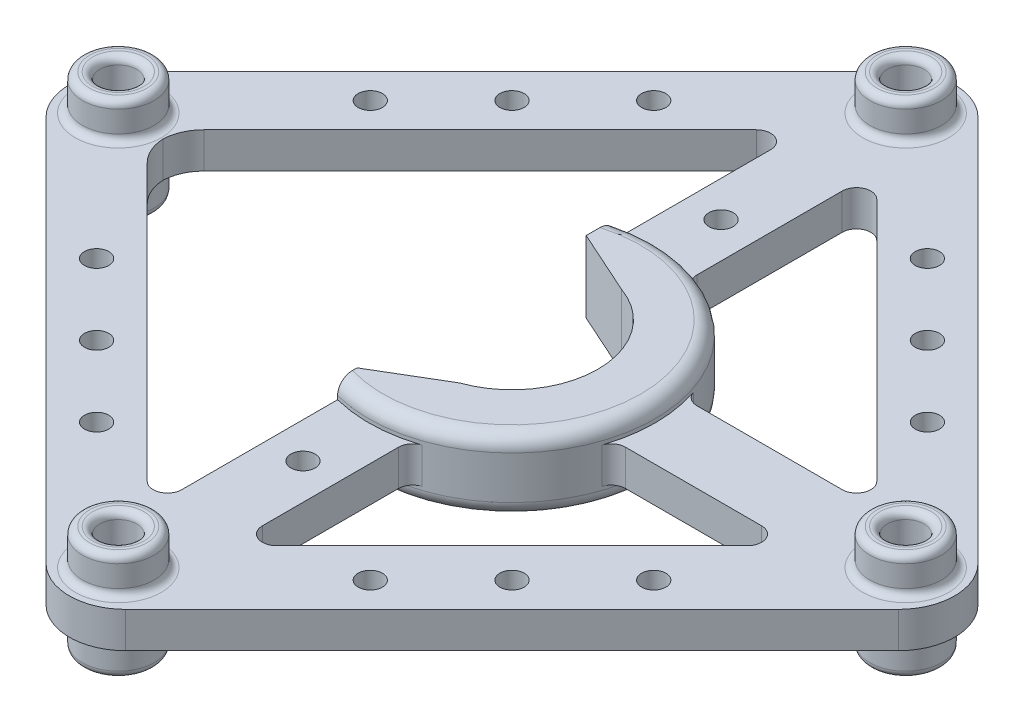
from build123d import *
from build123d.topology import SkipClean

# Parameters (mm, degrees)
SKETCH1_R                                  = 25.4
SKETCH1_R_2                                = 15.24
BOSS_EXTRUDE1_DEPTH                        = 6.35
BOSS_EXTRUDE2_START                        = -6.35
BOSS_EXTRUDE2_DEPTH                        = 3.175
CIRPATTERN1_COUNT                          = 4
CUT_EXTRUDE1_DEPTH                         = 111.990216985
BOSS_EXTRUDE5_DEPTH                        = 3.175
MIRROR1_START                              = -3.175
MIRROR1_DEPTH                              = 3.175
MIRROR1_START_2                            = -6.35
MIRROR1_2_DEPTH                            = 3.175
FILLET4_R                                  = 2.54
BOSS_EXTRUDE7_DEPTH                        = 6.35
SKETCH16_R                                 = 7.9375
BOSS_EXTRUDE8_DEPTH                        = 6.35
MIRROR5_AT_THE_SECOND_PLANE_COPY_1_DEPTH   = 6.35
BOSS_EXTRUDE10_START                       = 6.35
SKETCH20_R                                 = 6.35
SKETCH20_R_2                               = 3.2639
BOSS_EXTRUDE10_DEPTH                       = 6.35
CIRPATTERN5_COUNT                          = 4
FILLET6_R                                  = 10
FILLET7_R                                  = 2.54
SKETCH18_R                                 = 2.15265
CUT_EXTRUDE4_DEPTH                         = 112.789343907
MIRROR6_AT_THE_SECOND_PLANE_COPY_1_SKETC_R = 2.15265
MIRROR6_AT_THE_SECOND_PLANE_COPY_1_DEPTH   = 112.789343907
FILLET8_R                                  = 2.54
FILLET10_R                                 = 7.62
FILLET11_R                                 = 1.27
CIRPATTERN7_COUNT                          = 4
FILLET11_OF_CIRPATTERN7_R                  = 1.27
SKETCH21_R                                 = 2.15265
CUT_EXTRUDE5_DEPTH                         = 112.789343907


# Read off the part's stored shape, not the designer's step: Mirror1, Mirror8
with BuildPart() as part:
    # Sketch1 → Boss-Extrude1 (new body)
    with BuildSketch(Plane(origin=(0, 0, 0), x_dir=(1, 0, 0), z_dir=(0, 1, 0))):
        with Locations(Location((0, 0, 0), (0, 0, 270))):
            Circle(SKETCH1_R)
        with Locations(Location((0, 0, 0), (0, 0, 270))):
            Circle(SKETCH1_R_2, mode=Mode.SUBTRACT)
    extrude(amount=BOSS_EXTRUDE1_DEPTH)

    # Sketch2 → Boss-Extrude2 (add)
    with BuildSketch(Plane(origin=(0, 6.35, 0), x_dir=(1, 0, 0), z_dir=(0, 1, 0)).offset(BOSS_EXTRUDE2_START)):
        with BuildLine():
            Line((73.590884631, -6.35), (16.699754169, -6.35))
            Line((16.699754169, -6.35), (16.699754169, 6.35))
            Line((16.699754169, 6.35), (73.590884631, 6.35))
            ThreePointArc((73.590884631, 6.35), (76.958480677, 4.955096045), (78.353384631, 1.5875))
            Line((78.353384631, 1.5875), (78.353384631, -1.5875))
            ThreePointArc((78.353384631, -1.5875), (76.958480677, -4.955096045), (73.590884631, -6.35))
        make_face()
    boss_extrude2 = extrude(amount=BOSS_EXTRUDE2_DEPTH)

    # CirPattern1: Boss-Extrude2 ×4 about axis
    cirpattern1_axis = Axis((0, 0, 0), (0, 1, 0))
    for i in range(1, CIRPATTERN1_COUNT):
        add(boss_extrude2.rotate(cirpattern1_axis, i * 360 / CIRPATTERN1_COUNT))

    # Sketch5 → Cut-Extrude1 (cut, through all)
    with BuildSketch(Plane(origin=(0, 6.35, 0), x_dir=(1, 0, 0), z_dir=(0, 1, 0))):
        Polygon((-6.35, 19.513444248), (-6.35, 24.593444248), (-6.35, 52.536571615), (-88.152777481, 52.536571615), (-88.152777481, -52.536571615), (-6.35, -52.536571615), (-6.35, -26.229804731), (-6.35, -21.149804731), (5.08, -14.368409794), (5.08, 14.368409794), align=None)
    extrude(amount=-CUT_EXTRUDE1_DEPTH, mode=Mode.SUBTRACT)

    # Sketch12 → Boss-Extrude5 (add)
    with BuildSketch(Plane(origin=(0, 0, 0), x_dir=(1, 0, 0), z_dir=(0, 1, 0))):
        with BuildLine():
            Line((-3.367596045, -66.482403955), (66.482403955, 3.367596045))
            ThreePointArc((66.482403955, 3.367596045), (73.217596045, 3.367596045), (73.217596045, -3.367596045))
            Line((73.217596045, -3.367596045), (3.367596045, -73.217596045))
            ThreePointArc((3.367596045, -73.217596045), (-3.367596045, -73.217596045), (-3.367596045, -66.482403955))
        make_face()
    extrude(amount=BOSS_EXTRUDE5_DEPTH)

    # Mirror1 outline → Mirror1 (add)
    with BuildSketch(Plane(origin=(0, 0, 0), x_dir=(1, 0, 0), z_dir=(0, 1, 0)).offset(MIRROR1_START)):
        with BuildLine():
            Line((73.590884631, 6.35), (24.593444248, 6.35))
            ThreePointArc((24.593444248, 6.35), (17.960512242, 17.960512242), (6.35, 24.593444248))
            Line((6.35, 24.593444248), (6.35, 73.590884631))
            ThreePointArc((6.35, 73.590884631), (4.955096046, 76.958480677), (1.5875, 78.353384631))
            Line((1.5875, 78.353384631), (-1.5875, 78.353384631))
            ThreePointArc((-1.5875, 78.353384631), (-4.955096046, 76.958480677), (-6.35, 73.590884631))
            Line((-6.35, 73.590884631), (-6.35, 19.513444248))
            Line((-6.35, 19.513444248), (5.08, 14.368409794))
            ThreePointArc((5.08, 14.368409794), (15.24, 0), (5.08, -14.368409794))
            Line((5.08, -14.368409794), (-6.35, -21.149804731))
            Line((-6.35, -21.149804731), (-6.35, -73.590884631))
            ThreePointArc((-6.35, -73.590884631), (-4.955096046, -76.958480677), (-1.5875, -78.353384631))
            Line((-1.5875, -78.353384631), (1.5875, -78.353384631))
            ThreePointArc((1.5875, -78.353384631), (4.955096046, -76.958480677), (6.35, -73.590884631))
            Line((6.35, -73.590884631), (6.35, -70.235192091))
            Line((6.35, -70.235192091), (70.235192091, -6.35))
            Line((70.235192091, -6.35), (73.590884631, -6.35))
            ThreePointArc((73.590884631, -6.35), (76.958480677, -4.955096046), (78.353384631, -1.5875))
            Line((78.353384631, -1.5875), (78.353384631, 1.5875))
            ThreePointArc((78.353384631, 1.5875), (76.958480677, 4.955096046), (73.590884631, 6.35))
        make_face()
        with BuildLine():
            Line((24.593444248, -6.35), (56.764807909, -6.35))
            Line((56.764807909, -6.35), (6.35, -56.764807909))
            Line((6.35, -56.764807909), (6.35, -24.593444248))
            ThreePointArc((6.35, -24.593444248), (17.960512242, -17.960512242), (24.593444248, -6.35))
        make_face(mode=Mode.SUBTRACT)
    extrude(amount=MIRROR1_DEPTH)

    # Mirror1 2 outline → Mirror1 2 (add)
    with BuildSketch(Plane(origin=(0, 0, 0), x_dir=(1, 0, 0), z_dir=(0, 1, 0)).offset(MIRROR1_START_2)):
        with BuildLine():
            ThreePointArc((-6.35, -24.593444248), (25.4, 0), (-6.35, 24.593444248))
            Line((-6.35, 24.593444248), (-6.35, 19.513444248))
            Line((-6.35, 19.513444248), (5.08, 14.368409794))
            ThreePointArc((5.08, 14.368409794), (15.24, 0), (5.08, -14.368409794))
            Line((5.08, -14.368409794), (-6.35, -21.149804731))
            Line((-6.35, -21.149804731), (-6.35, -24.593444248))
        make_face()
    extrude(amount=MIRROR1_2_DEPTH)

    # Fillet4
    # the kernel refuses this fillet: 2.54 mm, written as the material it adds along each edge
    with BuildSketch(Plane(origin=(24.593444248, 3.175, -6.35), x_dir=(1, 0, 0), z_dir=(0, -1, 0)), Plane(origin=(6.35, 3.175, 24.593444248), x_dir=(0, 0, 1), z_dir=(0, -1, 0)), Plane(origin=(6.35, -3.175, -24.593444248), x_dir=(0, 0, -1), z_dir=(0, 1, 0))) as fillet4_piece_1:
        with BuildLine():
            CenterArc((1.894505842, -2.54), FILLET4_R, 90, 71.446995465)
            ThreePointArc((-0.513489621, -1.731818182), (-0.241344994, -0.870475186), (0, 0))
            Line((0, 0), (1.894505842, 0))
        make_face()
    extrude(amount=3.175)
    with BuildSketch(Plane(origin=(24.593444248, 3.175, 6.35), x_dir=(1, 0, 0), z_dir=(0, -1, 0)), Plane(origin=(6.35, 3.175, -24.593444248), x_dir=(0, 0, -1), z_dir=(0, -1, 0))) as fillet4_piece_2:
        with BuildLine():
            CenterArc((1.894505842, 2.54), FILLET4_R, 198.553004535, 71.446995465)
            ThreePointArc((-0.513489621, 1.731818182), (-0.241344994, 0.870475186), (0, 0))
            Line((0, 0), (1.894505842, 0))
        make_face()
    extrude(amount=3.175)
    with BuildSketch(Plane(origin=(6.35, -3.175, 24.593444248), x_dir=(0.9587440651387001, 0, -0.2842706765766038), z_dir=(0, 1, 0)), Plane(origin=(24.593444248, -3.175, -6.35), x_dir=(-0.2842706765766039, 0, -0.9587440651387), z_dir=(0, 1, 0))) as fillet4_piece_3:
        with BuildLine():
            CenterArc((1.896657468, -2.538393751), FILLET4_R, 92.037746175, 71.446995466)
            Line((-0.538552458, -1.816346233), (0, 0))
            ThreePointArc((0, 0), (0.903170223, -0.016062489), (1.806340446, 0))
        make_face()
    extrude(amount=3.175)
    with BuildSketch(Plane(origin=(24.593444248, -3.175, 6.35), x_dir=(-0.2842706765766016, 0, 0.9587440651387007), z_dir=(0, 1, 0))) as fillet4_piece_4:
        with BuildLine():
            CenterArc((1.896657468, 2.538393751), FILLET4_R, 196.515258359, 71.446995466)
            Line((-0.538552458, 1.816346233), (0, 0))
            ThreePointArc((0, 0), (0.903170223, 0.016062489), (1.806340446, 0))
        make_face()
    extrude(amount=3.175)

    # Sketch15 → Boss-Extrude7 (add)
    with SkipClean():  # the faces are left unmerged after this step: merging them gives an invalid solid
        with BuildSketch(Plane(origin=(0, 3.175, 0), x_dir=(1, 0, 0), z_dir=(0, 1, 0))):
            Polygon((-82.677748493, 0), (0, -82.677), (0, -64.716569057), (-64.71715495, 0), align=None)
        boss_extrude7 = extrude(amount=-BOSS_EXTRUDE7_DEPTH)

    # Sketch16 → Boss-Extrude8 (add)
    with SkipClean():  # the faces are left unmerged after this step: merging them gives an invalid solid
        with BuildSketch(Plane(origin=(0, 3.175, 0), x_dir=(1, 0, 0), z_dir=(0, 1, 0))):
            with Locations((-69.85, 0)):
                Circle(SKETCH16_R)
        extrude(amount=-BOSS_EXTRUDE8_DEPTH)

    # Mirror5: Boss-Extrude7 across plane
    with SkipClean():  # the faces are left unmerged after this step: merging them gives an invalid solid
        add(boss_extrude7.mirror(Plane(origin=(0, 0, 0), x_dir=(0, 0, 1), z_dir=(1, 0, 0))))

    # Mirror5 at the second plane: Boss-Extrude7 across plane
    with SkipClean():  # the faces are left unmerged after this step: merging them gives an invalid solid
        add(boss_extrude7.mirror(Plane.XY))

    # Mirror5 at the second plane copy 1 sketc → Mirror5 at the second plane copy 1 (add)
    with SkipClean():  # the faces are left unmerged after this step: merging them gives an invalid solid
        with BuildSketch(Plane(origin=(0, 3.175, 0), x_dir=(-1, 0, 0), z_dir=(0, 1, 0))):
            Polygon((-82.677748493, 0), (0, -82.677), (0, -64.716569057), (-64.71715495, 0), align=None)
        extrude(amount=-MIRROR5_AT_THE_SECOND_PLANE_COPY_1_DEPTH)

    # Sketch14 → F (0.257) Diameter Hole2 (revolve, cut)
    with SkipClean():  # the faces are left unmerged after this step: merging them gives an invalid solid
        with BuildSketch(Plane(origin=(0, 3.175, 69.85), x_dir=(0, 0, 1), z_dir=(1, 0, 0))):
            Polygon((0, 0), (0, 52.761148974), (3.2639, 50.8), (3.2639, 0), align=None)
        f_0_257_diameter_hole2 = revolve(axis=Axis((0, 9.525, 69.85), (0, -1, 0)), mode=Mode.SUBTRACT)

    # Sketch20 → Boss-Extrude10 (add)
    with SkipClean():  # the faces are left unmerged after this step: merging them gives an invalid solid
        with BuildSketch(Plane(origin=(0, 3.175, 0), x_dir=(1, 0, 0), z_dir=(0, 1, 0)).offset(BOSS_EXTRUDE10_START)):
            with Locations(Location((0, -69.85, 0), (0, 0, 270))):
                Circle(SKETCH20_R)
            with Locations(Location((0, -69.85, 0), (0, 0, 270))):
                Circle(SKETCH20_R_2, mode=Mode.SUBTRACT)
        boss_extrude10 = extrude(amount=-BOSS_EXTRUDE10_DEPTH)

    # CirPattern5: F (0.257) Diameter Hole2 ×4 about axis
    with SkipClean():  # the faces are left unmerged after this step: merging them gives an invalid solid
        cirpattern5_axis = Axis((0, 0, 0), (0, 1, 0))
        for i in range(1, CIRPATTERN5_COUNT):
            add(f_0_257_diameter_hole2.rotate(cirpattern5_axis, i * 360 / CIRPATTERN5_COUNT), mode=Mode.SUBTRACT)

    # Fillet6
    # the kernel refuses this fillet: 10 mm, written as the material it takes off along each edge
    with BuildSketch(Plane(origin=(0, 28.174773672, 82.677), x_dir=(0.7071099819596428, 0, -0.7071035803989637), z_dir=(0, -1, 0))) as fillet6_piece_1:
        with BuildLine():
            CenterArc((FILLET6_R * 0.999990946867, -FILLET6_R), FILLET6_R, 90, 89.999481291)
            Line((-FILLET6_R * 9.05309197351e-06, -FILLET6_R * 0.999990946826), (0, 0))
            Line((0, 0), (FILLET6_R * 0.999990946867, 0))
        make_face()
    extrude(amount=56.349547343, mode=Mode.SUBTRACT)
    with BuildSketch(Plane(origin=(-82.677748493, 28.17522633, 0), x_dir=(0.7071099819596426, 0, 0.7071035803989637), z_dir=(0, -1, 0)), Plane(origin=(82.677748493, 28.17522633, 0), x_dir=(-0.7071099819596426, 0, -0.7071035803989637), z_dir=(0, -1, 0))) as fillet6_piece_2:
        with BuildLine():
            CenterArc((FILLET6_R * 1.00000905321, -FILLET6_R), FILLET6_R, 90, 90.000518709)
            Line((FILLET6_R * 9.05325589292e-06, -FILLET6_R * 1.00000905317), (0, 0))
            Line((0, 0), (FILLET6_R * 1.00000905321, 0))
        make_face()
    extrude(amount=56.350452661, mode=Mode.SUBTRACT)
    with BuildSketch(Plane(origin=(0, 28.174773672, -82.677), x_dir=(0.7071099819596428, 0, 0.7071035803989637), z_dir=(0, -1, 0))) as fillet6_piece_3:
        with BuildLine():
            CenterArc((FILLET6_R * 0.999990946867, FILLET6_R), FILLET6_R, 180.000518709, 89.999481291)
            Line((-FILLET6_R * 9.05309197351e-06, FILLET6_R * 0.999990946826), (0, 0))
            Line((0, 0), (FILLET6_R * 0.999990946867, 0))
        make_face()
    extrude(amount=56.349547343, mode=Mode.SUBTRACT)

    # Fillet7
    fillet7_edges = [part.edges().sort_by_distance(p)[0] for p in [
        (25.4, 6.35, 0),
        (25.4, -6.35, 0),
    ]]
    fillet(fillet7_edges, radius=FILLET7_R)

    # Sketch18 → Cut-Extrude4 (cut, through all)
    with BuildSketch(Plane.XZ.offset(3.175)):
        with Locations(Location((-36.848702495, 36.84841563, 0), (0, 0, 270))):
            Circle(SKETCH18_R)
        with Locations(Location((-49.421117974, 24.27611397, 0), (0, 0, 270))):
            Circle(SKETCH18_R)
        with Locations(Location((-24.276287016, 49.420717289, 0), (0, 0, 270))):
            Circle(SKETCH18_R)
    cut_extrude4 = extrude(amount=-CUT_EXTRUDE4_DEPTH, mode=Mode.SUBTRACT)

    # Mirror6: Cut-Extrude4 across plane
    add(cut_extrude4.mirror(Plane(origin=(0, 0, 0), x_dir=(0, 0, 1), z_dir=(1, 0, 0))), mode=Mode.SUBTRACT)

    # Mirror6 at the second plane: Cut-Extrude4 across plane
    add(cut_extrude4.mirror(Plane.XY), mode=Mode.SUBTRACT)

    # Mirror6 at the second plane copy 1 sketc → Mirror6 at the second plane copy 1 (cut, through all)
    with BuildSketch(Plane(origin=(0, -3.175, 0), x_dir=(-1, 0, 0), z_dir=(0, -1, 0))):
        with Locations(Location((-36.848702495, 36.84841563, 0), (0, 0, 270))):
            Circle(MIRROR6_AT_THE_SECOND_PLANE_COPY_1_SKETC_R)
        with Locations(Location((-49.421117974, 24.27611397, 0), (0, 0, 270))):
            Circle(MIRROR6_AT_THE_SECOND_PLANE_COPY_1_SKETC_R)
        with Locations(Location((-24.276287016, 49.420717289, 0), (0, 0, 270))):
            Circle(MIRROR6_AT_THE_SECOND_PLANE_COPY_1_SKETC_R)
    extrude(amount=-MIRROR6_AT_THE_SECOND_PLANE_COPY_1_DEPTH, mode=Mode.SUBTRACT)

    # Fillet8
    fillet8_edges = [part.edges().sort_by_distance(p)[0] for p in [
        (56.764807909, 1.5875, 6.35),
        (6.35, 1.5875, 56.764807909),
        (-6.35, 0, 58.366626545),
        (-6.35, 0, -58.366626545),
        (58.367097462, 0, -6.35),
        (6.35, 0, -58.366626545),
    ]]
    fillet(fillet8_edges, radius=FILLET8_R)

    # Fillet10
    # the kernel refuses this fillet: 7.62 mm, written as the material it adds along each edge
    with BuildSketch(Plane(origin=(-62.292036451, -3.175, 2.425096544), x_dir=(0.14331424263929318, 0, -0.9896772341812888), z_dir=(0, 1, 0))) as fillet10_piece_1:
        with BuildLine():
            CenterArc((3.898021094, -7.514395522), FILLET10_R, 99.55001733, 43.689914902)
            Line((-2.206731735, -2.954089294), (0, 0))
            ThreePointArc((0, 0), (1.316899018, -0.110004665), (2.633798037, 0))
        make_face()
    extrude(amount=6.35)
    with BuildSketch(Plane(origin=(-62.292036451, -3.175, -2.425096544), x_dir=(0.7071099819596419, 0, -0.7071035803989645), z_dir=(0, 1, 0))) as fillet10_piece_2:
        with BuildLine():
            CenterArc((3.687317251, -7.62), FILLET10_R, 90, 43.689914902)
            ThreePointArc((-1.576236954, -2.110063782), (-0.699988387, -1.120865875), (0, 0))
            Line((0, 0), (3.687317251, 0))
        make_face()
    extrude(amount=6.35)

    # Fillet11
    fillet11_edges = [part.edges().sort_by_distance(p)[0] for p in [
        (0, 9.525, 63.5),
        (0, 3.175, 63.5),
        (0, 9.525, 66.5861),
    ]]
    fillet(fillet11_edges, radius=FILLET11_R)

    # CirPattern7: Boss-Extrude10 ×4 about axis
    cirpattern7_axis = Axis((0, 0, 0), (0, 1, 0))
    for i in range(1, CIRPATTERN7_COUNT):
        add(boss_extrude10.rotate(cirpattern7_axis, i * 360 / CIRPATTERN7_COUNT))

    # Fillet11 of CirPattern7
    fillet11_of_cirpattern7_edges = [part.edges().sort_by_distance(p)[0] for p in [
        (63.5, 9.525, 0),
        (63.5, 3.175, 0),
        (66.5861, 9.525, 0),
        (0, 9.525, -63.5),
        (0, 3.175, -63.5),
        (0, 9.525, -66.5861),
        (-63.5, 9.525, 0),
        (-63.5, 3.175, 0),
        (-66.5861, 9.525, 0),
    ]]
    fillet(fillet11_of_cirpattern7_edges, radius=FILLET11_OF_CIRPATTERN7_R)

    # Mirror8 outline → Mirror8 (revolve)
    with BuildSketch(Plane.XY.offset(69.85)):
        with BuildLine():
            Line((3.2639, -3.175), (3.2639, -8.255))
            ThreePointArc((3.2639, -8.255), (3.635874388, -9.153025612), (4.5339, -9.525))
            Line((4.5339, -9.525), (5.08, -9.525))
            ThreePointArc((5.08, -9.525), (5.978025612, -9.153025612), (6.35, -8.255))
            Line((6.35, -8.255), (6.35, -3.175))
            Line((6.35, -3.175), (3.2639, -3.175))
        make_face()
    revolve(axis=Axis((0, 0, 69.85), (0, 1, 0)))

    # Mirror8 2 outline → Mirror8 2 (revolve)
    with BuildSketch(Plane(origin=(69.85, 0, 0), x_dir=(1, 0, 0), z_dir=(0, 0, 1))):
        with BuildLine():
            Line((3.2639, -3.175), (3.2639, -8.255))
            ThreePointArc((3.2639, -8.255), (3.635874388, -9.153025612), (4.5339, -9.525))
            Line((4.5339, -9.525), (5.08, -9.525))
            ThreePointArc((5.08, -9.525), (5.978025612, -9.153025612), (6.35, -8.255))
            Line((6.35, -8.255), (6.35, -3.175))
            Line((6.35, -3.175), (3.2639, -3.175))
        make_face()
    revolve(axis=Axis((69.85, 0, 0), (0, 1, 0)))

    # Mirror8 3 outline → Mirror8 3 (revolve)
    with BuildSketch(Plane.XY.offset(-69.85)):
        with BuildLine():
            Line((3.2639, -3.175), (3.2639, -8.255))
            ThreePointArc((3.2639, -8.255), (3.635874388, -9.153025612), (4.5339, -9.525))
            Line((4.5339, -9.525), (5.08, -9.525))
            ThreePointArc((5.08, -9.525), (5.978025612, -9.153025612), (6.35, -8.255))
            Line((6.35, -8.255), (6.35, -3.175))
            Line((6.35, -3.175), (3.2639, -3.175))
        make_face()
    revolve(axis=Axis((0, 0, -69.85), (0, 1, 0)))

    # Mirror8 4 outline → Mirror8 4 (revolve)
    with BuildSketch(Plane(origin=(-69.85, 0, 0), x_dir=(1, 0, 0), z_dir=(0, 0, 1))):
        with BuildLine():
            Line((3.2639, -3.175), (3.2639, -8.255))
            ThreePointArc((3.2639, -8.255), (3.635874388, -9.153025612), (4.5339, -9.525))
            Line((4.5339, -9.525), (5.08, -9.525))
            ThreePointArc((5.08, -9.525), (5.978025612, -9.153025612), (6.35, -8.255))
            Line((6.35, -8.255), (6.35, -3.175))
            Line((6.35, -3.175), (3.2639, -3.175))
        make_face()
    revolve(axis=Axis((-69.85, 0, 0), (0, 1, 0)))

    # Sketch21 → Cut-Extrude5 (cut, through all)
    with BuildSketch(Plane(origin=(0, 3.175, 0), x_dir=(1, 0, 0), z_dir=(0, 1, 0))):
        with Locations(Location((0, 37.084, 0), (0, 0, 270))):
            Circle(SKETCH21_R)
        with Locations(Location((0, -37.084, 0), (0, 0, 270))):
            Circle(SKETCH21_R)
    extrude(amount=-CUT_EXTRUDE5_DEPTH, mode=Mode.SUBTRACT)


solid = part.part
